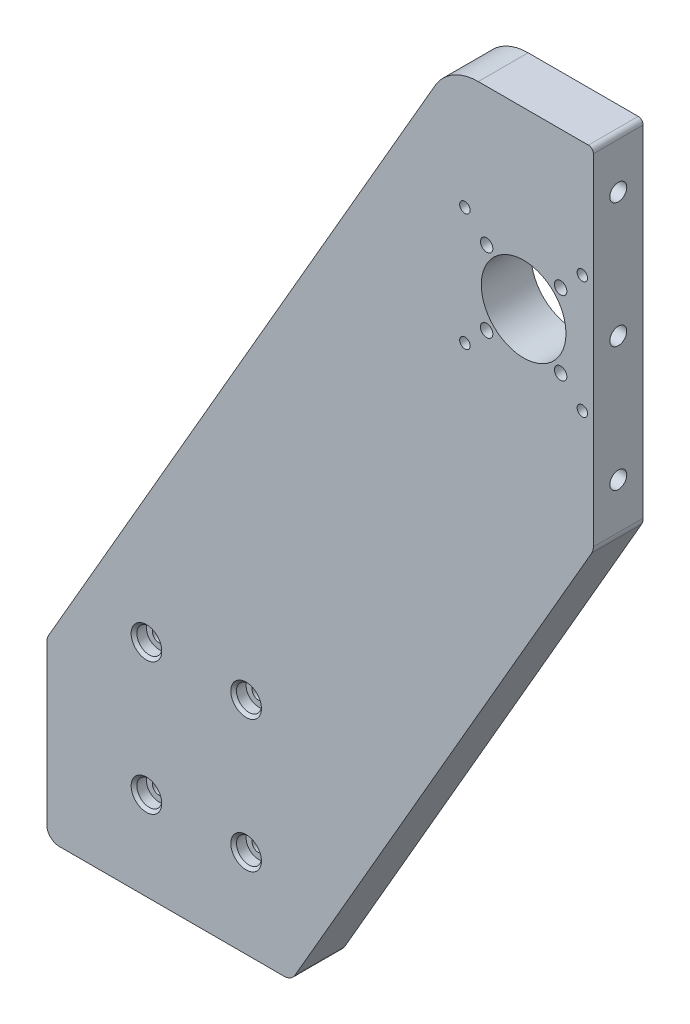
from build123d import *

# Parameters (mm, degrees)
SCHIZZO1_R                    = 17
SCHIZZO1_R_2                  = 2.5
ESTRUSIONE_ESTRUSIONE2_DEPTH  = 20
M5_TAPPED_HOLE1_D             = 4.2
M5_TAPPED_HOLE1_DEPTH         = 17.4
M5_TAPPED_HOLE1_TIP           = 1.2618073
CBORE_FOR_M5_SHCS1_AT_2_COUNT = 2
CBORE_FOR_M5_SHCS1_AT_2_PITCH = 53
CBORE_FOR_M5_SHCS1_AT_3_COUNT = 2
CBORE_FOR_M5_SHCS1_AT_3_PITCH = 66.400301204
CBORE_FOR_M5_SHCS1_AT_4_COUNT = 2
CBORE_FOR_M5_SHCS1_AT_4_PITCH = 40
M8_TAPPED_HOLE1_D             = 6.8
M8_TAPPED_HOLE1_DEPTH         = 15.75
M8_TAPPED_HOLE1_TIP           = 2.042926105
M5_TAPPED_HOLE2_D             = 4.2


with BuildPart() as part:
    # Schizzo1 → Estrusione-Estrusione2 (new body)
    with BuildSketch(Plane.XY):
        with BuildLine():
            Line((5, 0), (95.262794416, 0))
            ThreePointArc((95.262794416, 0), (97.762794416, 0.669872981), (99.592921435, 2.5))
            Line((99.592921435, 2.5), (218.723229311, 208.839745962))
            ThreePointArc((218.723229311, 208.839745962), (219.222731424, 210.045650737), (219.393102292, 211.339745962))
            Line((219.393102292, 211.339745962), (219.393102292, 348))
            ThreePointArc((219.393102292, 348), (218.807315854, 349.414213562), (217.393102292, 350))
            Line((217.393102292, 350), (173.205080757, 350))
            ThreePointArc((173.205080757, 350), (163.205080757, 347.320508076), (155.884572681, 340))
            Line((155.884572681, 340), (0.669872981, 71.160254038))
            ThreePointArc((0.669872981, 71.160254038), (0.170370869, 69.954349263), (0, 68.660254038))
            Line((0, 68.660254038), (0, 5))
            ThreePointArc((0, 5), (1.464466094, 1.464466094), (5, 0))
        make_face()
        with Locations((191.393102292, 280)):
            Circle(SCHIZZO1_R, mode=Mode.SUBTRACT)
        with Locations((206.242344697, 294.849242405)):
            Circle(SCHIZZO1_R_2, mode=Mode.SUBTRACT)
        with Locations((206.242344697, 265.150757595)):
            Circle(SCHIZZO1_R_2, mode=Mode.SUBTRACT)
        with Locations((176.543859887, 265.150757595)):
            Circle(SCHIZZO1_R_2, mode=Mode.SUBTRACT)
        with Locations((176.543859887, 294.849242405)):
            Circle(SCHIZZO1_R_2, mode=Mode.SUBTRACT)
    extrude(amount=-ESTRUSIONE_ESTRUSIONE2_DEPTH)

    # M5 Tapped Hole1
    with Locations(Plane(origin=(50.131397208, 0, -10), x_dir=(0, 0, -1), z_dir=(0, -1, 0))):
        with Locations((0, 0), (0, 35), (0, -35)):
            Hole(M5_TAPPED_HOLE1_D / 2, depth=M5_TAPPED_HOLE1_DEPTH)
            with Locations((0, 0, -(M5_TAPPED_HOLE1_DEPTH + M5_TAPPED_HOLE1_TIP / 2))):  # 118° drill point
                Cone(0, M5_TAPPED_HOLE1_D / 2, M5_TAPPED_HOLE1_TIP, mode=Mode.SUBTRACT)

    # Sketch5 → CBORE for M5 SHCS1 (revolve, cut)
    with BuildSketch(Plane(origin=(80, 88.5, 0), x_dir=(0, -1, 0), z_dir=(1, 0, 0))):
        Polygon((0, 0), (0, 20), (2.65, 20), (2.65, 5), (5, 5), (5, 1.145), (6.145, 0), align=None)
    cbore_for_m5_shcs1 = revolve(axis=Axis((80, 88.5, 6.35), (0, 0, -1)), mode=Mode.SUBTRACT)

    # CBORE for M5 SHCS1 at 2: CBORE for M5 SHCS1 ×2
    with Locations(*[(0, -i * CBORE_FOR_M5_SHCS1_AT_2_PITCH, 0) for i in range(1, CBORE_FOR_M5_SHCS1_AT_2_COUNT)]):
        add(cbore_for_m5_shcs1, mode=Mode.SUBTRACT)

    # CBORE for M5 SHCS1 at 3: CBORE for M5 SHCS1 ×2
    with Locations(*[Vector(-0.6024069059118463, -0.7981891503332503, 0) * (i * CBORE_FOR_M5_SHCS1_AT_3_PITCH) for i in range(1, CBORE_FOR_M5_SHCS1_AT_3_COUNT)]):
        add(cbore_for_m5_shcs1, mode=Mode.SUBTRACT)

    # CBORE for M5 SHCS1 at 4: CBORE for M5 SHCS1 ×2
    with Locations(*[(-i * CBORE_FOR_M5_SHCS1_AT_4_PITCH, 0, 0) for i in range(1, CBORE_FOR_M5_SHCS1_AT_4_COUNT)]):
        add(cbore_for_m5_shcs1, mode=Mode.SUBTRACT)

    # M8 Tapped Hole1
    with Locations(Plane(origin=(219.393102292, 329.669872981, -10), x_dir=(0, 0, 1), z_dir=(1, 0, 0))):
        with Locations((0, 0), (0, 50), (0, 100)):
            Hole(M8_TAPPED_HOLE1_D / 2, depth=M8_TAPPED_HOLE1_DEPTH)
            with Locations((0, 0, -(M8_TAPPED_HOLE1_DEPTH + M8_TAPPED_HOLE1_TIP / 2))):  # 118° drill point
                Cone(0, M8_TAPPED_HOLE1_D / 2, M8_TAPPED_HOLE1_TIP, mode=Mode.SUBTRACT)

    # M5 Tapped Hole2 (through all)
    with Locations(Plane(origin=(214.963102292, 303.57, 0), x_dir=(1, 0, 0), z_dir=(0, 0, 1))):
        with Locations((0, 0), (-47.14, 0), (-47.14, -47.14), (0, -47.14)):
            Hole(M5_TAPPED_HOLE2_D / 2)


solid = part.part
